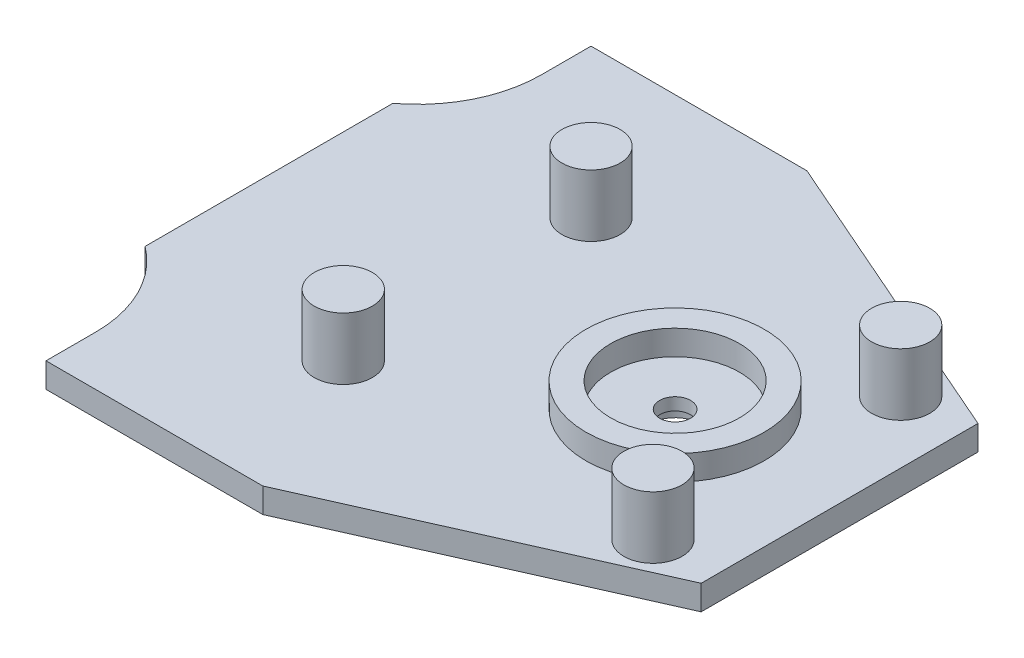
from build123d import *

# Parameters (mm, degrees)
BOSS_EXTRUDE2_DEPTH = 2
FILLET1_R           = 10
SKETCH3_R           = 7.2
SKETCH3_R_2         = 5.2
BOSS_EXTRUDE3_DEPTH = 2
SKETCH4_R           = 1.25
CUT_EXTRUDE1_DEPTH  = 2
SKETCH5_R           = 2
CUT_EXTRUDE2_DEPTH  = 1
SKETCH6_R           = 2.35
BOSS_EXTRUDE4_DEPTH = 5


with BuildPart() as part:
    # Sketch1 → Boss-Extrude2 (new body)
    with BuildSketch(Plane(origin=(0, 0, 0), x_dir=(1, 0, 0), z_dir=(0, 1, 0))):
        Polygon((-17.219288225, -19.914865419), (0.286329753, -19.914865419), (24.780711775, -9.023800613), (24.780711775, 13.326199387), (0.209283204, 24.085134581), (-17.219288225, 24.085134581), (-17.219288225, 12.085134581), (-21.219288225, 12.085134581), (-21.219288225, -7.914865419), (-17.219288225, -7.914865419), align=None)
    extrude(amount=BOSS_EXTRUDE2_DEPTH)

    # Fillet1
    # the kernel refuses this fillet: 10 mm, written as the material it adds along each edge
    with BuildSketch(Plane(origin=(-17.219288225, 0, 7.914865419), x_dir=(-1, 0, 0), z_dir=(0, 1, 0))) as fillet1_piece_1:
        with BuildLine():
            CenterArc((10, 8), FILLET1_R, 180, 53.130102354)
            Line((0, 8), (-0.2, 8))
            Line((-0.2, 8), (-0.2, 0))
            Line((-0.2, 0), (0, -0.2))
            ThreePointArc((0, -0.2), (2, -0.2), (3.88, -0.16))
            Line((3.88, -0.16), (4, 0))
        make_face()
    extrude(amount=2)
    with BuildSketch(Plane(origin=(-17.219288225, 0, -12.085134581), x_dir=(0, 0, -1), z_dir=(0, 1, 0))) as fillet1_piece_2:
        with BuildLine():
            CenterArc((8, 10), FILLET1_R, 216.869897646, 53.130102354)
            Line((0, 4), (-0.16, 3.88))
            ThreePointArc((-0.16, 3.88), (-0.2, 2), (-0.2, 0))
            Line((-0.2, 0), (0, -0.2))
            Line((0, -0.2), (8, -0.2))
            Line((8, -0.2), (8, 0))
        make_face()
    extrude(amount=2)

    # Sketch3 → Boss-Extrude3 (add)
    with BuildSketch(Plane(origin=(0, 2, 0), x_dir=(1, 0, 0), z_dir=(0, 1, 0))):
        with Locations(Location((11.568463112, 2.085134581, 0), (0, 0, 270))):
            Circle(SKETCH3_R)
        with Locations(Location((11.568463112, 2.085134581, 0), (0, 0, 270))):
            Circle(SKETCH3_R_2, mode=Mode.SUBTRACT)
    extrude(amount=BOSS_EXTRUDE3_DEPTH)

    # Sketch4 → Cut-Extrude1 (cut)
    with BuildSketch(Plane.XZ):
        with Locations(Location((11.568463112, -2.085134581, 0), (0, 0, 270))):
            Circle(SKETCH4_R)
    extrude(amount=-CUT_EXTRUDE1_DEPTH, mode=Mode.SUBTRACT)

    # Sketch5 → Cut-Extrude2 (cut)
    with BuildSketch(Plane.XZ):
        with Locations(Location((11.568463112, -2.085134581, 0), (0, 0, 270))):
            Circle(SKETCH5_R)
    extrude(amount=-CUT_EXTRUDE2_DEPTH, mode=Mode.SUBTRACT)

    # Sketch6 → Boss-Extrude4 (add)
    with BuildSketch(Plane(origin=(0, 2, 0), x_dir=(1, 0, 0), z_dir=(0, 1, 0))):
        with Locations(Location((19.780711775, -7.914865419, 0), (0, 0, 270))):
            Circle(SKETCH6_R)
        with Locations(Location((19.780711775, 12.085134581, 0), (0, 0, 270))):
            Circle(SKETCH6_R)
        with Locations(Location((-5.219288225, -7.914865419, 0), (0, 0, 270))):
            Circle(SKETCH6_R)
        with Locations(Location((-5.219288225, 12.085134581, 0), (0, 0, 270))):
            Circle(SKETCH6_R)
    extrude(amount=BOSS_EXTRUDE4_DEPTH)


solid = part.part
